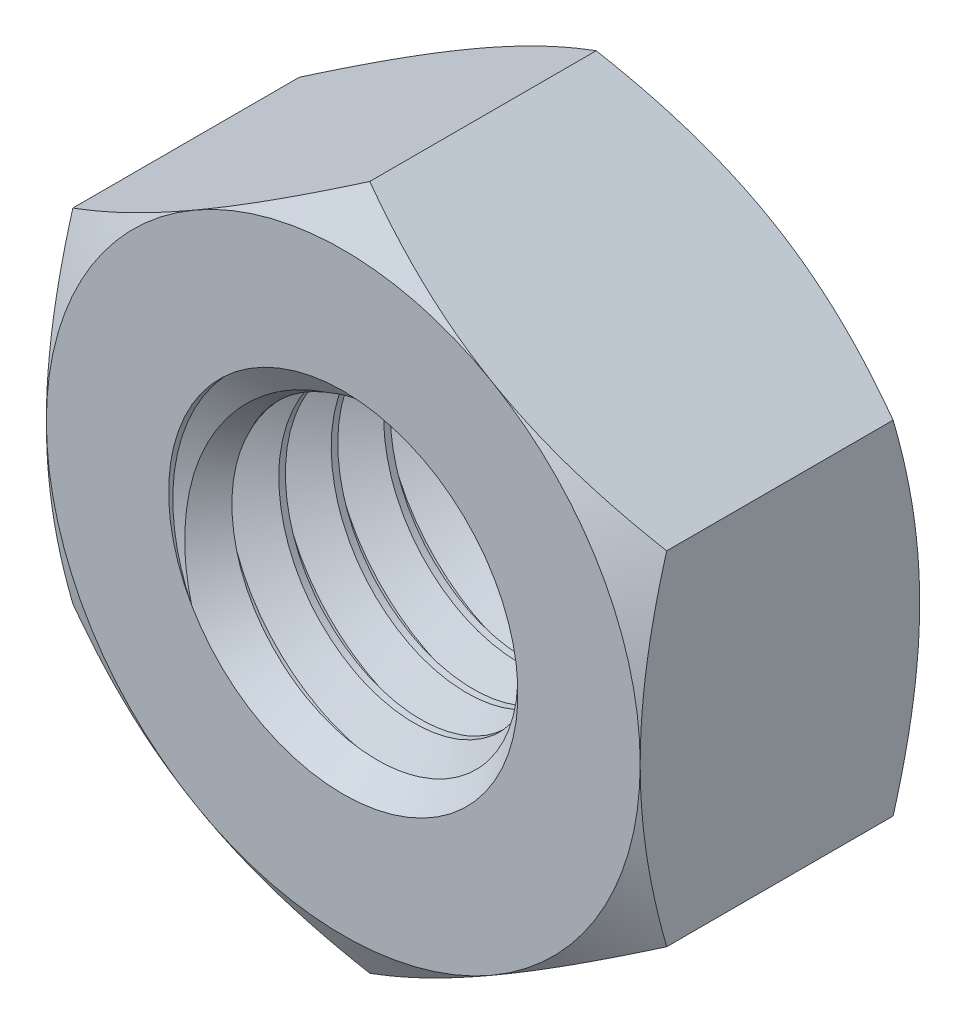
from build123d import *

# Parameters (mm, degrees)
EXTRUDE1_DEPTH          = 4
SKETCH13_R              = 5
BOSS_EXTRUDE1_DEPTH     = 8
CUT_SWEEP1_PITCH        = 1.5
SKETCH7_OUTSIDE_W       = 112.422
SKETCH7_OUTSIDE_H       = 115.052
SKETCH7_OUTSIDE_R       = 8.5
EXTRUDE2_DEPTH          = 25.4
EXTRUDE2_DRAFT          = -60
MIRROR2_COPY_1_SKETCH_W = 112.422
MIRROR2_COPY_1_SKETCH_H = 115.052
MIRROR2_COPY_1_SKETCH_R = 8.5
MIRROR2_COPY_1_DEPTH    = 25.4
MIRROR2_COPY_1_DRAFT    = -60


with BuildPart() as part:
    # Sketch1 → Extrude1 (new, symmetric)
    with BuildSketch(Plane.XY):
        Polygon((-8.5, 4.907477288), (-8.5, -4.907477288), (0, -9.814954576), (8.5, -4.907477288), (8.5, 4.907477288), (0, 9.814954576), align=None)
    extrude(amount=EXTRUDE1_DEPTH, both=True)

    # Cut-Extrude2 cone 1 section (through the dimple's axis) → Cut-Extrude2 (revolve, cut)
    with BuildSketch(Plane(origin=(0, 0, 4), x_dir=(0, -1, 0), z_dir=(1, 0, 0))):
        Polygon((0, 0), (5, 0), (0, 5), align=None)
    revolve(axis=Axis((0, 0, 4), (0, 0, -1)), mode=Mode.SUBTRACT)

    # Cut-Extrude3 cone 1 section (through the dimple's axis) → Cut-Extrude3 (revolve, cut)
    with BuildSketch(Plane(origin=(0, 0, -4), x_dir=(0, 1, 0), z_dir=(1, 0, 0))):
        Polygon((0, 0), (5, 0), (0, 5), align=None)
    revolve(axis=Axis((0, 0, -4), (0, 0, 1)), mode=Mode.SUBTRACT)


with BuildPart() as body_2:
    # Sketch13 → Boss-Extrude1 (new body)
    with BuildSketch(Plane(origin=(0, 0, -4), x_dir=(-1, 0, 0), z_dir=(0, 0, -1))):
        Circle(SKETCH13_R)
    extrude(amount=-BOSS_EXTRUDE1_DEPTH)

    # Cut-Sweep1: arcs per turn and ends read off the stored shape
    # Cut-Sweep1: the profile of Sketch12 profile screwed along a right-hand helix through 7 turns, 8 arcs to a turn; built about Z, then put on its axis
    cut_sweep1_z = Axis((0, 0, 0), (0, 0, 1))
    cut_sweep1_corners = [(5.0003, 0, -2.812673205), (5.0003, 0, -1.499826795), (4.025721421, 0, -2.0625), (4.025721421, 0, -2.25)]
    with BuildLine(mode=Mode.PRIVATE) as cut_sweep1_profile:
        Line(cut_sweep1_corners[0], cut_sweep1_corners[1])
        Line(cut_sweep1_corners[1], cut_sweep1_corners[2])
        Line(cut_sweep1_corners[2], cut_sweep1_corners[3])
        Line(cut_sweep1_corners[3], cut_sweep1_corners[0])
    cut_sweep1_cap = Face(cut_sweep1_profile.wire())
    cut_sweep1_turn_angles = [0, 22.5, 45, 67.5, 90, 112.5, 135, 157.5, 180, 202.5, 225, 247.5, 270, 292.5, 315, 337.5, 360]
    cut_sweep1_turn_weights = [1, 0.9238795325112867, 1, 0.9238795325112867, 1, 0.9238795325112867, 1, 0.9238795325112867, 1, 0.9238795325112867, 1, 0.9238795325112867, 1, 0.9238795325112867, 1, 0.9238795325112867, 1]
    cut_sweep1_turn_rails = [Edge.make_bspline([Vector(p[0], p[1], 0).rotate(cut_sweep1_z, cut_sweep1_turn_angles[k]) / cut_sweep1_turn_weights[k] + Vector(0, 0, p[2] + CUT_SWEEP1_PITCH * cut_sweep1_turn_angles[k] / 360) for k in range(17)], [0, 0, 0, 1, 1, 2, 2, 3, 3, 4, 4, 5, 5, 6, 6, 7, 7, 8, 8, 8], 2, cut_sweep1_turn_weights) for p in cut_sweep1_corners]
    cut_sweep1_turn_sides = [Face.make_surface_from_curves(cut_sweep1_turn_rails[p[0]], cut_sweep1_turn_rails[p[1]]) for p in [(0, 1), (1, 2), (2, 3), (3, 0)]]
    cut_sweep1 = Plane(origin=(0, 0, -4), x_dir=(0, 1, 0), z_dir=(0, 0, 1)) * Solid(Shell([*[p.moved(Location((0, 0, CUT_SWEEP1_PITCH * i))) for i in range(7) for p in cut_sweep1_turn_sides], cut_sweep1_cap, cut_sweep1_cap.rotate(cut_sweep1_z, 2520).moved(Location((0, 0, CUT_SWEEP1_PITCH * 2520 / 360)))]))
    add(cut_sweep1, mode=Mode.SUBTRACT)


with BuildPart() as part_1:
    add(part.part)

    # Combine1: cut body 2
    add(body_2.part, mode=Mode.SUBTRACT)


with BuildPart() as extrude2_tool:
    # Sketch7 outside → Extrude2 (with draft: the straight prism first)
    with BuildSketch(Plane.XY.offset(4)):
        Rectangle(SKETCH7_OUTSIDE_W, SKETCH7_OUTSIDE_H)
        Circle(SKETCH7_OUTSIDE_R, mode=Mode.SUBTRACT)
    extrude(amount=-EXTRUDE2_DEPTH)
    # Extrude2: the draft: its side faces are tilted about the plane it starts from
    extrude2_sides = [extrude2_tool.faces().sort_by_distance(p)[0] for p in [
        (0, -57.526, -8.7),
        (56.211, 0, -8.7),
        (0, 57.526, -8.7),
        (-56.211, 0, -8.7),
        (-8.5, 0, -8.7),
    ]]
    draft(extrude2_sides, Plane.XY.offset(4), EXTRUDE2_DRAFT)


with BuildPart() as part_2:
    add(part_1.part)

    # Extrude2: cut by extrude2_tool
    add(extrude2_tool.part, mode=Mode.SUBTRACT)


with BuildPart() as mirror2_copy_1_tool:
    # Mirror2 copy 1 sketch → Mirror2 copy 1 (with draft: the straight prism first)
    with BuildSketch(Plane(origin=(0, 0, -4), x_dir=(1, 0, 0), z_dir=(0, 0, -1))):
        Rectangle(MIRROR2_COPY_1_SKETCH_W, MIRROR2_COPY_1_SKETCH_H)
        Circle(MIRROR2_COPY_1_SKETCH_R, mode=Mode.SUBTRACT)
    extrude(amount=-MIRROR2_COPY_1_DEPTH)
    # Mirror2 copy 1: the draft: its side faces are tilted about the plane it starts from
    mirror2_copy_1_sides = [mirror2_copy_1_tool.faces().sort_by_distance(p)[0] for p in [
        (0, -57.526, 8.7),
        (56.211, 0, 8.7),
        (0, 57.526, 8.7),
        (-56.211, 0, 8.7),
        (-8.5, 0, 8.7),
    ]]
    draft(mirror2_copy_1_sides, Plane(origin=(0, 0, -4), x_dir=(1, 0, 0), z_dir=(0, 0, -1)), MIRROR2_COPY_1_DRAFT)


with BuildPart() as part_3:
    add(part_2.part)

    # Mirror2 copy 1: cut by mirror2_copy_1_tool
    add(mirror2_copy_1_tool.part, mode=Mode.SUBTRACT)


solid = part_3.part
